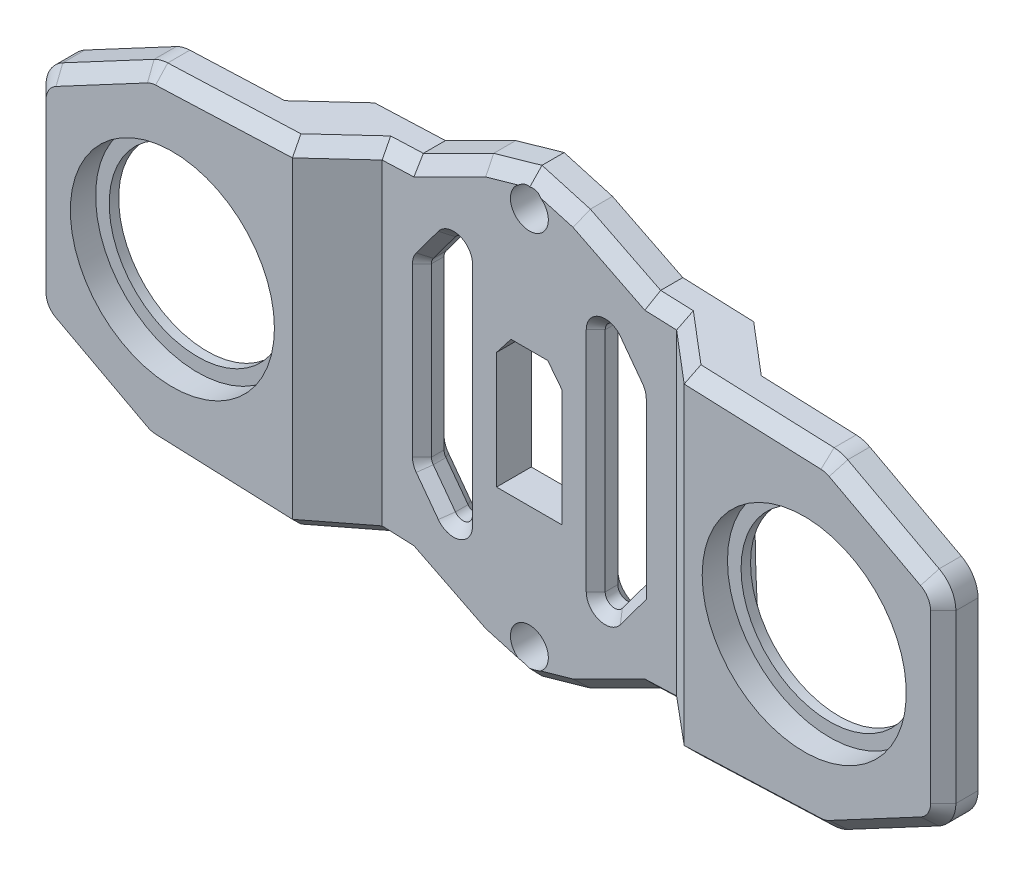
from build123d import *

# Parameters (mm, degrees)
SKETCH1_R               = 3
SKETCH1_R_2             = 16.15
BOSS_EXTRUDE1_DEPTH     = 12
CUT_EXTRUDE1_DEPTH      = 81.950602221
CUT_EXTRUDE1_DEPTH_BACK = 81.950602221
CUT_EXTRUDE2_DEPTH      = 81.319673804
CUT_EXTRUDE2_DEPTH_BACK = 81.319673804
CUT_EXTRUDE3_DEPTH      = 81.319673804
CUT_EXTRUDE3_DEPTH_BACK = 81.319673804
FILLET1_R               = 1.5
SKETCH5_R               = 18.073165259
SKETCH5_R_2             = 14
BOSS_EXTRUDE2_DEPTH     = 1.5
FILLET2_R               = 5
CHAMFER1_SIZE           = 1.951251552
CHAMFER1_SIZE_2         = 2
SKETCH7_R               = 18.5
CUT_EXTRUDE4_DEPTH      = 81.319673804
CHAMFER2_SIZE           = 2
CHAMFER3_SIZE           = 1.5


with BuildPart() as part:
    # Sketch1 → Boss-Extrude1 (new body)
    with BuildSketch(Plane.XY):
        Polygon((-72, 16.21061599), (-72, -16.21061599), (-53.874481608, -25.873120341), (-18.780890439, -27.25079114), (-7.646290238, -32.818629475), (0, -35), (7.646290238, -32.818629475), (18.780890439, -27.25079114), (53.874481608, -25.873120341), (72, -16.21061599), (72, 16.21061599), (53.874481608, 25.873120341), (18.780890439, 27.25079114), (7.646290238, 32.818629475), (0, 35), (-7.646290238, 32.818629475), (-18.780890439, 27.25079114), (-53.874481608, 25.873120341), align=None)
        with Locations((0, 30)):
            Circle(SKETCH1_R, mode=Mode.SUBTRACT)
        with Locations((-50, 0)):
            Circle(SKETCH1_R_2, mode=Mode.SUBTRACT)
        with Locations(Location((0, -30, 0), (0, 0, 180))):
            Circle(SKETCH1_R, mode=Mode.SUBTRACT)
        with Locations(Location((50, 0, 0), (0, 0, 180))):
            Circle(SKETCH1_R_2, mode=Mode.SUBTRACT)
    extrude(amount=BOSS_EXTRUDE1_DEPTH)

    # Sketch2 → Cut-Extrude1 (cut, two sides: drawn at the far end of the back side and taken through both)
    with BuildSketch(Plane(origin=(0, 0, 0), x_dir=(1, 0, 0), z_dir=(0, 1, 0)).offset(-CUT_EXTRUDE1_DEPTH_BACK)):
        Polygon((-31, -12), (-23.3, -5.5), (4.394576276, -5.5), (23.3, -5.5), (31, -12), align=None)
        Polygon((-72, 0), (-72, -6.5), (-37.7, -6.5), (-30, 0), align=None)
        Polygon((30, 0), (72, 0), (72, -6.5), (37.7, -6.5), align=None)
    extrude(amount=CUT_EXTRUDE1_DEPTH + CUT_EXTRUDE1_DEPTH_BACK, mode=Mode.SUBTRACT)

    # Sketch3 → Cut-Extrude2 (cut, two sides: drawn at the far end of the back side and taken through both)
    with BuildSketch(Plane.XY.offset(5.5).offset(-CUT_EXTRUDE2_DEPTH_BACK)):
        Polygon((5.2, -10.7), (-5.2, -10.7), (-5.2, 7.758003241), (-2.908652734, 10.7), (2.908652734, 10.7), (5.2, 7.758003241), align=None)
    extrude(amount=CUT_EXTRUDE2_DEPTH + CUT_EXTRUDE2_DEPTH_BACK, mode=Mode.SUBTRACT)

    # Sketch4 → Cut-Extrude3 (cut, two sides: drawn at the far end of the back side and taken through both)
    with BuildSketch(Plane.XY.offset(5.5).offset(-CUT_EXTRUDE3_DEPTH_BACK)):
        Polygon((-17, 13.75), (-17, -13.75), (-10.5, -22.5), (-10.5, 22.5), align=None)
        Polygon((17, 13.75), (10.5, 22.5), (10.5, -22.5), (17, -13.75), align=None)
    extrude(amount=CUT_EXTRUDE3_DEPTH + CUT_EXTRUDE3_DEPTH_BACK, mode=Mode.SUBTRACT)

    # Fillet1
    fillet1_edges = [part.edges().sort_by_distance(p)[0] for p in [
        (-10.5, -22.5, 2.75),
        (-17, -13.75, 2.75),
        (-17, 13.75, 2.75),
        (-10.5, 22.5, 2.75),
        (17, 13.75, 2.75),
        (10.5, -22.5, 2.75),
        (10.5, 22.5, 2.75),
    ]]
    fillet(fillet1_edges, radius=FILLET1_R)

    # Sketch5 → Boss-Extrude2 (add)
    # profile 1 of 2: a face of its own
    with BuildSketch(Plane.XY.offset(6.5)):
        with Locations((-50, 0)):
            Circle(SKETCH5_R)
        with Locations((-50, 0)):
            Circle(SKETCH5_R_2, mode=Mode.SUBTRACT)
    # profile 2 of 2: a face of its own
    with BuildSketch(Plane.XY.offset(6.5)):
        with Locations((50, 0)):
            Circle(SKETCH5_R)
        with Locations(Location((50, 0, 0), (0, 0, 180))):
            Circle(SKETCH5_R_2, mode=Mode.SUBTRACT)
    extrude(amount=BOSS_EXTRUDE2_DEPTH)

    # Fillet2
    fillet2_edges = [part.edges().sort_by_distance(p)[0] for p in [
        (53.874481608, 25.873120341, 9.25),
        (72, 16.21061599, 9.25),
        (72, -16.21061599, 9.25),
        (53.874481608, -25.873120341, 9.25),
        (-53.874481608, -25.873120341, 9.25),
        (-72, -16.21061599, 9.25),
        (-72, 16.21061599, 9.25),
        (-53.874481608, 25.873120341, 9.25),
    ]]
    fillet(fillet2_edges, radius=FILLET2_R)

    # Chamfer1
    # the kernel refuses this chamfer: 2, 1.951251552 mm, written as the material it takes off along each edge
    with BuildSketch(Plane(origin=(-34.928477381, 26.616884542, 15.31624714), x_dir=(-0.6442657871235674, -0.025291973037495013, -0.7643833538493108), z_dir=(0.7637950321222882, 0.02998433836577936, -0.6447620401032301))) as chamfer1_piece_1_section:
        Polygon((CHAMFER1_SIZE, 0), (CHAMFER1_SIZE_2 * 0.0253033502172, -CHAMFER1_SIZE_2 * 0.999679818976), (0, 0), align=None)
    chamfer1_piece_1 = extrude(amount=20.367970604, mode=Mode.PRIVATE)
    chamfer1_piece_1 = split(chamfer1_piece_1, bisect_by=Plane(origin=(-34.696720403, 20.713308268, 9.40812357), z_dir=(-0.02773755980041179, 0.7065625434286197, 0.7071067811865465)), keep=Keep.TOP, mode=Mode.PRIVATE)
    add(chamfer1_piece_1, mode=Mode.SUBTRACT)
    with BuildSketch(Plane(origin=(-19.371522619, -27.227604664, 2.18375286), x_dir=(-0.6442657871235675, 0.025291973037495155, -0.7643833538493108), z_dir=(-0.7637950321222882, 0.029984338365779052, 0.6447620401032301))) as chamfer1_piece_2_section:
        Polygon((CHAMFER1_SIZE, 0), (CHAMFER1_SIZE_2 * 0.0253033502172, -CHAMFER1_SIZE_2 * 0.999679818976), (0, 0), align=None)
    chamfer1_piece_2 = extrude(amount=20.367970604, mode=Mode.PRIVATE)
    chamfer1_piece_2 = split(chamfer1_piece_2, bisect_by=Plane(origin=(-19.397338723, -27.885221697, 2.84187643), z_dir=(-0.027737559800411482, -0.7065625434286192, 0.7071067811865472)), keep=Keep.TOP, mode=Mode.PRIVATE)
    add(chamfer1_piece_2, mode=Mode.SUBTRACT)
    with BuildSketch(Plane(origin=(34.928477381, -26.616884542, 15.31624714), x_dir=(-0.0229121907246819, 0.9995503686422044, -0.019341459702652504), z_dir=(-0.7637950321222882, -0.029984338365779056, -0.6447620401032301))) as chamfer1_piece_3_section:
        Polygon((CHAMFER1_SIZE_2, 0), (CHAMFER1_SIZE * 0.0253033502215, CHAMFER1_SIZE * 0.999679819145), (0, 0), align=None)
    chamfer1_piece_3 = extrude(amount=20.367970604, mode=Mode.PRIVATE)
    chamfer1_piece_3 = split(chamfer1_piece_3, bisect_by=Plane(origin=(34.696720403, -20.713308268, 9.40812357), z_dir=(0.027737559800411475, -0.7065625434286189, 0.7071067811865472)), keep=Keep.TOP, mode=Mode.PRIVATE)
    add(chamfer1_piece_3, mode=Mode.SUBTRACT)
    with BuildSketch(Plane(origin=(19.371522619, 27.227604664, 2.18375286), x_dir=(0.6442657871235675, -0.025291973037493195, -0.7643833538493108), z_dir=(0.7637950321222882, -0.029984338365779364, 0.6447620401032301))) as chamfer1_piece_4_section:
        Polygon((CHAMFER1_SIZE, 0), (CHAMFER1_SIZE_2 * 0.0253033502172, -CHAMFER1_SIZE_2 * 0.999679818976), (0, 0), align=None)
    chamfer1_piece_4 = extrude(amount=20.367970604, mode=Mode.PRIVATE)
    chamfer1_piece_4 = split(chamfer1_piece_4, bisect_by=Plane(origin=(19.397338723, 27.885221697, 2.84187643), z_dir=(0.02773755980041176, 0.7065625434286189, 0.7071067811865472)), keep=Keep.TOP, mode=Mode.PRIVATE)
    add(chamfer1_piece_4, mode=Mode.SUBTRACT)
    with BuildSketch(Plane(origin=(6.154542051, -39.719712738, 5.5), x_dir=(0.447248183041441, 0.8944098963932197, 0), z_dir=(-0.8944098963932196, 0.447248183041441, 0))) as chamfer1_piece_5_section:
        Polygon((CHAMFER1_SIZE_2, 0), (0, CHAMFER1_SIZE_2), (0, 0), align=None)
    chamfer1_piece_5 = extrude(amount=33.022566094, mode=Mode.PRIVATE)
    chamfer1_piece_5 = split(chamfer1_piece_5, bisect_by=Plane(origin=(6.41895418, -32.984307454, -1.240593305), z_dir=(-0.027737559800411482, -0.7065625434286192, 0.7071067811865472)), keep=Keep.TOP, mode=Mode.PRIVATE)
    add(chamfer1_piece_5, mode=Mode.SUBTRACT)
    with BuildSketch(Plane(origin=(-13.641483149, -27.452549099, 5.5), x_dir=(0.03922683325687665, 0.9992303315815815, 0), z_dir=(-0.9992303315815815, 0.03922683325687665, 0))) as chamfer1_piece_6_section:
        Polygon((CHAMFER1_SIZE_2, 0), (0, CHAMFER1_SIZE_2), (0, 0), align=None)
    chamfer1_piece_6 = extrude(amount=14.809322408, mode=Mode.PRIVATE)
    chamfer1_piece_6 = split(chamfer1_piece_6, bisect_by=Plane(origin=(-13.667901262, -27.505380218, 5.559068128), z_dir=(-0.3162522231019654, -0.6324433029000034, 0.7071067811865472)), keep=Keep.TOP, mode=Mode.PRIVATE)
    chamfer1_piece_6 = split(chamfer1_piece_6, bisect_by=Plane(origin=(-16.250720077, -23.260463371, 2.214106929), z_dir=(0.4399193315437051, -0.7067888438044169, 0.5540040721941993)), keep=Keep.TOP, mode=Mode.PRIVATE)
    add(chamfer1_piece_6, mode=Mode.SUBTRACT)
    with BuildSketch(Plane(origin=(-13.641483149, -27.452549099, 5.5), x_dir=(0.03922683325687665, 0.9992303315815815, 0), z_dir=(-0.9992303315815815, 0.03922683325687665, 0))) as chamfer1_piece_7_section:
        Polygon((CHAMFER1_SIZE_2, 0), (0, CHAMFER1_SIZE_2), (0, 0), align=None)
    chamfer1_piece_7 = extrude(amount=14.809322408, mode=Mode.PRIVATE)
    chamfer1_piece_7 = split(chamfer1_piece_7, bisect_by=Plane(origin=(-17.660316485, -27.452549099, 0.739228202), z_dir=(0.6450520757438959, 0, 0.7641386128043075)), keep=Keep.TOP, mode=Mode.PRIVATE)
    chamfer1_piece_7 = split(chamfer1_piece_7, bisect_by=Plane(origin=(-16.250720077, -23.260463371, 2.214106929), z_dir=(-0.4399193315437051, 0.7067888438044169, -0.5540040721941993)), keep=Keep.TOP, mode=Mode.PRIVATE)
    add(chamfer1_piece_7, mode=Mode.SUBTRACT)
    with BuildSketch(Plane(origin=(-28.43940729, 26.871626279, 5.5), x_dir=(0.03922683325687705, -0.9992303315815815, 0), z_dir=(0.9992303315815815, 0.03922683325687705, 0))) as chamfer1_piece_8_section:
        Polygon((CHAMFER1_SIZE_2, 0), (0, CHAMFER1_SIZE_2), (0, 0), align=None)
    chamfer1_piece_8 = extrude(amount=14.809322408, mode=Mode.PRIVATE)
    chamfer1_piece_8 = split(chamfer1_piece_8, bisect_by=Plane(origin=(-28.00419011, 27.570860491, 6.048082507), z_dir=(0.43991933154370405, 0.7067888438044181, 0.5540040721941986)), keep=Keep.TOP, mode=Mode.PRIVATE)
    chamfer1_piece_8 = split(chamfer1_piece_8, bisect_by=Plane(origin=(-27.101995388, 24.197061048, 2.509687346), z_dir=(-0.3162522231019656, 0.6324433029000034, 0.7071067811865471)), keep=Keep.TOP, mode=Mode.PRIVATE)
    add(chamfer1_piece_8, mode=Mode.SUBTRACT)
    with BuildSketch(Plane(origin=(-28.43940729, 26.871626279, 5.5), x_dir=(0.03922683325687705, -0.9992303315815815, 0), z_dir=(0.9992303315815815, 0.03922683325687705, 0))) as chamfer1_piece_9_section:
        Polygon((CHAMFER1_SIZE_2, 0), (0, CHAMFER1_SIZE_2), (0, 0), align=None)
    chamfer1_piece_9 = extrude(amount=14.809322408, mode=Mode.PRIVATE)
    chamfer1_piece_9 = split(chamfer1_piece_9, bisect_by=Plane(origin=(-26.300940104, 26.871626279, 8.033261127), z_dir=(0.6450520757438959, 0, 0.7641386128043075)), keep=Keep.TOP, mode=Mode.PRIVATE)
    chamfer1_piece_9 = split(chamfer1_piece_9, bisect_by=Plane(origin=(-27.101995388, 24.197061048, 2.509687346), z_dir=(-0.3162522231019656, 0.6324433029000034, 0.7071067811865471)), keep=Keep.TOP, mode=Mode.PRIVATE)
    add(chamfer1_piece_9, mode=Mode.SUBTRACT)
    with BuildSketch(Plane(origin=(-23.381167869, 24.950430052, 5.5), x_dir=(0.44724818304144126, -0.8944098963932194, 0), z_dir=(0.8944098963932194, 0.4472481830414412, 0))) as chamfer1_piece_10_section:
        Polygon((CHAMFER1_SIZE_2, 0), (0, CHAMFER1_SIZE_2), (0, 0), align=None)
    chamfer1_piece_10 = extrude(amount=33.022566094, mode=Mode.PRIVATE)
    chamfer1_piece_10 = split(chamfer1_piece_10, bisect_by=Plane(origin=(-23.383484924, 25.009452718, 5.559068128), z_dir=(-0.02773755980041179, 0.7065625434286197, 0.7071067811865465)), keep=Keep.TOP, mode=Mode.PRIVATE)
    add(chamfer1_piece_10, mode=Mode.SUBTRACT)
    with BuildSketch(Plane(origin=(-22.484381035, 28.585547432, 5.5), x_dir=(0.2743392856793401, -0.9616329634184497, 0), z_dir=(0.9616329634184497, 0.27433928567934, 0)), Plane(origin=(-4.946030265, 36.411027348, 5.5), x_dir=(-0.2743392856793395, -0.96163296341845, 0), z_dir=(0.96163296341845, -0.27433928567933946, 0)), Plane(origin=(22.484381035, -28.585547432, 5.5), x_dir=(-0.2743392856793401, 0.9616329634184497, 0), z_dir=(-0.9616329634184497, -0.27433928567934, 0)), Plane(origin=(4.946030265, -36.411027348, 5.5), x_dir=(0.27433928567934, 0.9616329634184497, 0), z_dir=(-0.9616329634184497, 0.27433928567934, 0))) as chamfer1_piece_11:
        Polygon((CHAMFER1_SIZE_2, 0), (0, CHAMFER1_SIZE_2), (0, 0), align=None)
    extrude(amount=28.524824276, mode=Mode.SUBTRACT)
    with BuildSketch(Plane(origin=(-6.154542051, 39.719712738, 5.5), x_dir=(0, 0, -1), z_dir=(0.8944098963932194, -0.4472481830414412, 0))) as chamfer1_piece_12_section:
        Polygon((CHAMFER1_SIZE_2, 0), (0, -CHAMFER1_SIZE_2), (0, 0), align=None)
    chamfer1_piece_12 = extrude(amount=33.022566094, mode=Mode.PRIVATE)
    chamfer1_piece_12 = split(chamfer1_piece_12, bisect_by=Plane(origin=(-6.41895418, 32.984307454, -1.240593305), z_dir=(0.02773755980041176, 0.7065625434286189, 0.7071067811865472)), keep=Keep.TOP, mode=Mode.PRIVATE)
    add(chamfer1_piece_12, mode=Mode.SUBTRACT)
    with BuildSketch(Plane(origin=(13.641483149, 27.452549099, 5.5), x_dir=(0, 0, -1), z_dir=(0.9992303315815815, -0.03922683325687705, 0))) as chamfer1_piece_13_section:
        Polygon((CHAMFER1_SIZE_2, 0), (0, -CHAMFER1_SIZE_2), (0, 0), align=None)
    chamfer1_piece_13 = extrude(amount=14.809322408, mode=Mode.PRIVATE)
    chamfer1_piece_13 = split(chamfer1_piece_13, bisect_by=Plane(origin=(13.667901262, 27.505380218, 5.559068128), z_dir=(0.3162522231019655, 0.6324433029000031, 0.7071067811865475)), keep=Keep.TOP, mode=Mode.PRIVATE)
    chamfer1_piece_13 = split(chamfer1_piece_13, bisect_by=Plane(origin=(16.250720077, 23.260463371, 2.214106929), z_dir=(-0.4399193315437042, 0.7067888438044179, 0.5540040721941988)), keep=Keep.TOP, mode=Mode.PRIVATE)
    add(chamfer1_piece_13, mode=Mode.SUBTRACT)
    with BuildSketch(Plane(origin=(13.641483149, 27.452549099, 5.5), x_dir=(0, 0, -1), z_dir=(0.9992303315815815, -0.03922683325687705, 0))) as chamfer1_piece_14_section:
        Polygon((CHAMFER1_SIZE_2, 0), (0, -CHAMFER1_SIZE_2), (0, 0), align=None)
    chamfer1_piece_14 = extrude(amount=14.809322408, mode=Mode.PRIVATE)
    chamfer1_piece_14 = split(chamfer1_piece_14, bisect_by=Plane(origin=(17.660316485, 27.452549099, 0.739228202), z_dir=(-0.6450520757438958, 0, 0.7641386128043075)), keep=Keep.TOP, mode=Mode.PRIVATE)
    chamfer1_piece_14 = split(chamfer1_piece_14, bisect_by=Plane(origin=(16.250720077, 23.260463371, 2.214106929), z_dir=(0.4399193315437042, -0.7067888438044179, -0.5540040721941988)), keep=Keep.TOP, mode=Mode.PRIVATE)
    add(chamfer1_piece_14, mode=Mode.SUBTRACT)
    with BuildSketch(Plane(origin=(28.43940729, -26.871626279, 5.5), x_dir=(0, 0, -1), z_dir=(-0.9992303315815815, -0.03922683325687665, 0))) as chamfer1_piece_15_section:
        Polygon((CHAMFER1_SIZE_2, 0), (0, -CHAMFER1_SIZE_2), (0, 0), align=None)
    chamfer1_piece_15 = extrude(amount=14.809322408, mode=Mode.PRIVATE)
    chamfer1_piece_15 = split(chamfer1_piece_15, bisect_by=Plane(origin=(26.300940104, -26.871626279, 8.033261127), z_dir=(-0.6450520757438958, 0, 0.7641386128043075)), keep=Keep.TOP, mode=Mode.PRIVATE)
    chamfer1_piece_15 = split(chamfer1_piece_15, bisect_by=Plane(origin=(27.101995388, -24.197061048, 2.509687346), z_dir=(0.3162522231019655, -0.6324433029000036, 0.7071067811865468)), keep=Keep.TOP, mode=Mode.PRIVATE)
    add(chamfer1_piece_15, mode=Mode.SUBTRACT)
    with BuildSketch(Plane(origin=(28.43940729, -26.871626279, 5.5), x_dir=(0, 0, -1), z_dir=(-0.9992303315815815, -0.03922683325687665, 0))) as chamfer1_piece_16_section:
        Polygon((CHAMFER1_SIZE_2, 0), (0, -CHAMFER1_SIZE_2), (0, 0), align=None)
    chamfer1_piece_16 = extrude(amount=14.809322408, mode=Mode.PRIVATE)
    chamfer1_piece_16 = split(chamfer1_piece_16, bisect_by=Plane(origin=(27.101995388, -24.197061048, 2.509687346), z_dir=(0.3162522231019655, -0.6324433029000036, 0.7071067811865468)), keep=Keep.TOP, mode=Mode.PRIVATE)
    chamfer1_piece_16 = split(chamfer1_piece_16, bisect_by=Plane(origin=(28.00419011, -27.570860491, 6.048082507), z_dir=(-0.4399193315437042, -0.7067888438044181, 0.5540040721941983)), keep=Keep.TOP, mode=Mode.PRIVATE)
    add(chamfer1_piece_16, mode=Mode.SUBTRACT)
    with BuildSketch(Plane(origin=(23.381167869, -24.950430052, 5.5), x_dir=(-0.44724818304144104, 0.8944098963932197, 0), z_dir=(-0.8944098963932196, -0.447248183041441, 0))) as chamfer1_piece_17_section:
        Polygon((CHAMFER1_SIZE_2, 0), (0, CHAMFER1_SIZE_2), (0, 0), align=None)
    chamfer1_piece_17 = extrude(amount=33.022566094, mode=Mode.PRIVATE)
    chamfer1_piece_17 = split(chamfer1_piece_17, bisect_by=Plane(origin=(23.383484924, -25.009452718, 5.559068128), z_dir=(0.027737559800411475, -0.7065625434286189, 0.7071067811865472)), keep=Keep.TOP, mode=Mode.PRIVATE)
    add(chamfer1_piece_17, mode=Mode.SUBTRACT)
    with BuildSketch(Plane(origin=(52.729592793, 25.918065296, 12), x_dir=(-0.03922683325687704, -0.9992303315815815, 0), z_dir=(-0.9992303315815815, 0.03922683325687705, 0)), Plane(origin=(25.86059271, -26.972862927, 12), x_dir=(-0.03922683325687665, 0.9992303315815815, 0), z_dir=(0.9992303315815815, 0.03922683325687665, 0))) as chamfer1_piece_18:
        Polygon((CHAMFER1_SIZE_2, 0), (0, -CHAMFER1_SIZE_2), (0, 0), align=None)
    extrude(amount=26.889696232, mode=Mode.SUBTRACT)
    with BuildSketch(Plane(origin=(69.352099902, 17.622180927, 12), x_dir=(-0.4704199804445324, -0.8824426564930811, 0), z_dir=(-0.8824426564930811, 0.4704199804445324, 0)), Plane(origin=(54.885558529, -25.334126921, 12), x_dir=(-0.4704199804445329, 0.8824426564930808, 0), z_dir=(0.8824426564930808, 0.470419980444533, 0)), Plane(origin=(-69.352099902, -17.622180927, 12), x_dir=(0.4704199804445329, 0.8824426564930808, 0), z_dir=(0.8824426564930808, -0.470419980444533, 0)), Plane(origin=(-54.885558529, 25.334126921, 12), x_dir=(0.4704199804445324, -0.8824426564930811, 0), z_dir=(-0.8824426564930811, -0.4704199804445324, 0))) as chamfer1_piece_19:
        Polygon((CHAMFER1_SIZE_2, 0), (0, -CHAMFER1_SIZE_2), (0, 0), align=None)
    extrude(amount=16.393746684, mode=Mode.SUBTRACT)
    with BuildSketch(Plane(origin=(72, -13.209967644, 12), x_dir=(-1, 0, 0), z_dir=(0, 1, 0)), Plane(origin=(-72, 13.209967644, 12), x_dir=(1, 0, 0), z_dir=(0, -1, 0))) as chamfer1_piece_20:
        Polygon((CHAMFER1_SIZE_2, 0), (0, -CHAMFER1_SIZE_2), (0, 0), align=None)
    extrude(amount=26.419935288, mode=Mode.SUBTRACT)
    with BuildSketch(Plane(origin=(67, 13.209967644, 12), x_dir=(1, 0, 0), z_dir=(0, -1, 0))) as chamfer1_piece_21:
        Polygon((5 - CHAMFER1_SIZE_2, 0), (5, -CHAMFER1_SIZE_2), (5, 0), align=None)
    revolve(axis=Axis((67, 13.209967644, 12), (0, 0, 1)), revolution_arc=61.938438174, mode=Mode.SUBTRACT)
    with BuildSketch(Plane(origin=(67, -13.209967644, 12), x_dir=(0.47041998044453237, -0.8824426564930811, 0), z_dir=(-0.8824426564930811, -0.47041998044453237, 0))) as chamfer1_piece_22:
        Polygon((5 - CHAMFER1_SIZE_2, 0), (5, -CHAMFER1_SIZE_2), (5, 0), align=None)
    revolve(axis=Axis((67, -13.209967644, 12), (0, 0, 1)), revolution_arc=61.938438174, mode=Mode.SUBTRACT)
    with BuildSketch(Plane(origin=(52.533458626, -20.921913639, 12), x_dir=(0.4704199804445338, -0.8824426564930803, 0), z_dir=(0.8824426564930803, 0.4704199804445338, 0))) as chamfer1_piece_23:
        Polygon((5 - CHAMFER1_SIZE_2, 0), (5, CHAMFER1_SIZE_2), (5, 0), align=None)
    revolve(axis=Axis((52.533458626, -20.921913639, 12), (0, 0, -1)), revolution_arc=25.813453041, mode=Mode.SUBTRACT)
    with BuildSketch(Plane(origin=(52.533458626, 20.921913639, 12), x_dir=(0.47041998044453237, 0.8824426564930811, 0), z_dir=(0.8824426564930811, -0.47041998044453237, 0))) as chamfer1_piece_24:
        Polygon((5 - CHAMFER1_SIZE_2, 0), (5, -CHAMFER1_SIZE_2), (5, 0), align=None)
    revolve(axis=Axis((52.533458626, 20.921913639, 12), (0, 0, 1)), revolution_arc=25.813453041, mode=Mode.SUBTRACT)
    with BuildSketch(Plane(origin=(-52.729592793, -25.918065296, 12), x_dir=(0, 0, -1), z_dir=(0.9992303315815815, -0.03922683325687665, 0)), Plane(origin=(-25.86059271, 26.972862927, 12), x_dir=(0, 0, -1), z_dir=(-0.9992303315815815, -0.03922683325687705, 0))) as chamfer1_piece_25:
        Polygon((CHAMFER1_SIZE_2, 0), (0, CHAMFER1_SIZE_2), (0, 0), align=None)
    extrude(amount=26.889696232, mode=Mode.SUBTRACT)
    with BuildSketch(Plane(origin=(-67, 13.209967644, 12), x_dir=(-1, 0, 0), z_dir=(0, -1, 0))) as chamfer1_piece_26:
        Polygon((5 - CHAMFER1_SIZE_2, 0), (5, CHAMFER1_SIZE_2), (5, 0), align=None)
    revolve(axis=Axis((-67, 13.209967644, 12), (0, 0, -1)), revolution_arc=61.938438174, mode=Mode.SUBTRACT)
    with BuildSketch(Plane(origin=(-67, -13.209967644, 12), x_dir=(-1, 0, 0), z_dir=(0, 1, 0))) as chamfer1_piece_27:
        Polygon((5 - CHAMFER1_SIZE_2, 0), (5, -CHAMFER1_SIZE_2), (5, 0), align=None)
    revolve(axis=Axis((-67, -13.209967644, 12), (0, 0, 1)), revolution_arc=61.938438174, mode=Mode.SUBTRACT)
    with BuildSketch(Plane(origin=(-52.533458626, 20.921913639, 12), x_dir=(-0.47041998044453237, 0.8824426564930811, 0), z_dir=(-0.8824426564930811, -0.47041998044453237, 0))) as chamfer1_piece_28:
        Polygon((5, CHAMFER1_SIZE_2), (5 - CHAMFER1_SIZE_2, 0), (5, 0), align=None)
    revolve(axis=Axis((-52.533458626, 20.921913639, 12), (0, 0, -1)), revolution_arc=25.813453041, mode=Mode.SUBTRACT)
    with BuildSketch(Plane(origin=(-52.533458626, -20.921913639, 12), x_dir=(-0.47041998044453237, -0.8824426564930811, 0), z_dir=(-0.8824426564930811, 0.47041998044453237, 0))) as chamfer1_piece_29:
        Polygon((5 - CHAMFER1_SIZE_2, 0), (5, -CHAMFER1_SIZE_2), (5, 0), align=None)
    revolve(axis=Axis((-52.533458626, -20.921913639, 12), (0, 0, 1)), revolution_arc=25.813453041, mode=Mode.SUBTRACT)

    # Sketch7 → Cut-Extrude4 (cut, through all)
    with BuildSketch(Plane(origin=(0, 0, 6.5), x_dir=(-1, 0, 0), z_dir=(0, 0, -1))):
        with Locations((-50, 0)):
            Circle(SKETCH7_R)
        with Locations((50, 0)):
            Circle(SKETCH7_R)
    extrude(amount=CUT_EXTRUDE4_DEPTH, mode=Mode.SUBTRACT)

    # Chamfer2
    chamfer2_edges = [part.edges().sort_by_distance(p)[0] for p in [
        (17, -0.248090155, 0),
        (14.954115772, 16.504074922, 0),
        (10.5, 0, 0),
        (15.102057886, -16.304922077, 0),
        (-10.5, 0, 0),
        (-14.954115772, -16.504074922, 0),
        (-17, 0, 0),
        (-14.954115772, 16.504074922, 0),
        (16.924109135, 13.724896298, 0),
        (11.528923392, 19.389467286, 0),
        (11.528923392, -19.389467286, 0),
        (-11.528923392, -19.389467286, 0),
        (-16.924109135, -13.724896298, 0),
        (-16.924109135, 13.724896298, 0),
        (-11.528923392, 19.389467286, 0),
    ]]
    chamfer(chamfer2_edges, length=CHAMFER2_SIZE)

    # Chamfer3
    chamfer3_edges = [part.edges().sort_by_distance(p)[0] for p in [
        (15.102057886, -16.304922077, 5.5),
        (14.954115772, 16.504074922, 5.5),
        (17, -0.248090155, 5.5),
        (10.5, 0, 5.5),
        (-10.5, 0, 5.5),
        (-14.954115772, -16.504074922, 5.5),
        (-17, 0, 5.5),
        (-14.954115772, 16.504074922, 5.5),
        (16.924109135, 13.724896298, 5.5),
        (11.528923392, 19.389467286, 5.5),
        (11.528923392, -19.389467286, 5.5),
        (-11.528923392, -19.389467286, 5.5),
        (-16.924109135, -13.724896298, 5.5),
        (-16.924109135, 13.724896298, 5.5),
        (-11.528923392, 19.389467286, 5.5),
    ]]
    chamfer(chamfer3_edges, length=CHAMFER3_SIZE)


solid = part.part
